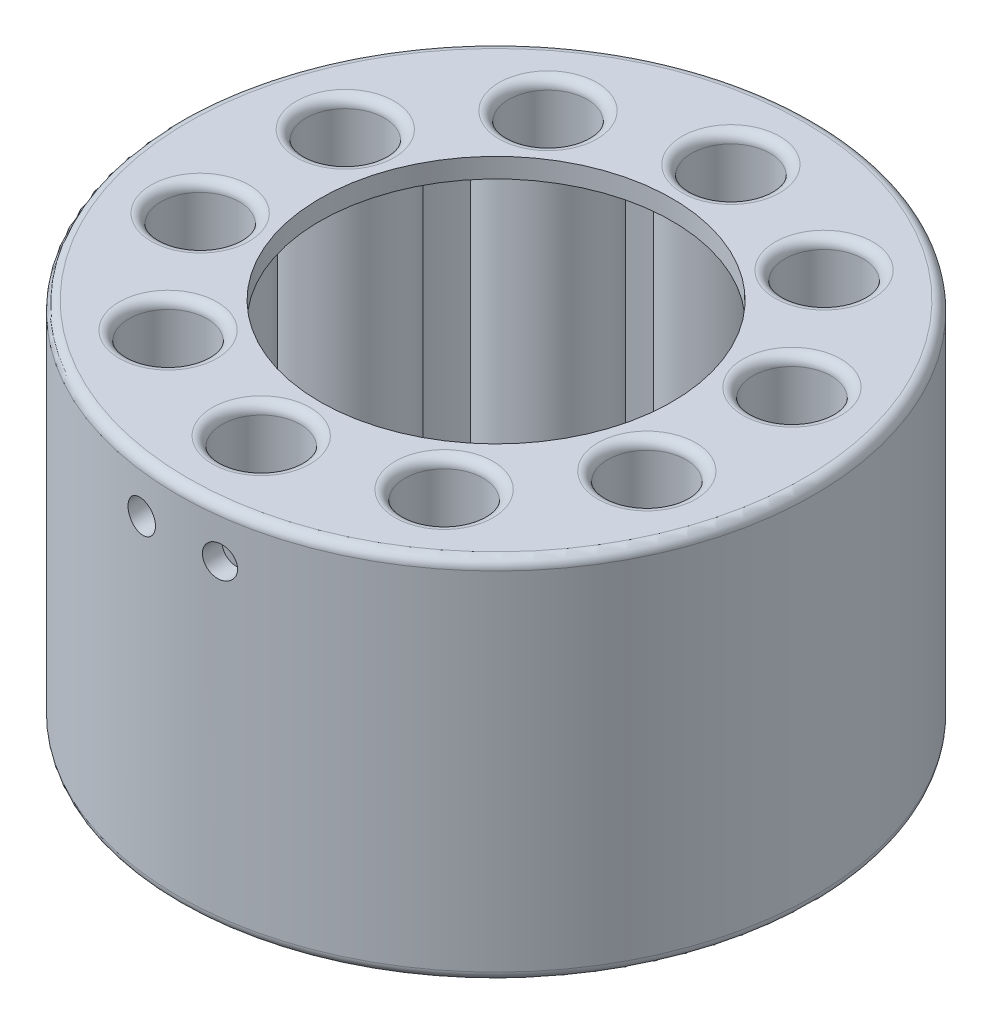
from build123d import *

# Parameters (mm, degrees)
SKETCH_5_R          = 32.5
SKETCH_5_R_2        = 4
EXTRUDE_1_DEPTH     = 2.5
SKETCH_5_4_R        = 32.5
SKETCH_5_4_R_2      = 30.5
SKETCH_5_4_R_3      = 5.6
SKETCH_5_4_R_4      = 4
EXTRUDE_2_DEPTH     = 37.5
SKETCH_6_R          = 32
EXTRUDE_3_DEPTH     = 2
SKETCH_5_5_R        = 4
CUT_EXTRUDE_1_DEPTH = 80
FILLET_1_R          = 1
FILLET_2_R          = 1
SKETCH_8_R          = 1.6
SKETCH_8_R_2        = 2.8
CUT_EXTRUDE_2_DEPTH = 5
SKETCH_15_R         = 1.6
CUT_EXTRUDE_3_DEPTH = 12
CUT_EXTRUDE_START   = 10
SKETCH_17_R         = 1.6
CUT_EXTRUDE_4_DEPTH = 10
SKETCH_18_R         = 18
CUT_EXTRUDE_5_DEPTH = 12


with BuildPart() as part:
    # 草图5 → 凸台-拉伸1 (new body)
    with BuildSketch(Plane(origin=(0, 0, 0), x_dir=(1, 0, 0), z_dir=(0, 1, 0))):
        Circle(SKETCH_5_R)
        with Locations((14.106846055, 19.416407865)):
            Circle(SKETCH_5_R_2, mode=Mode.SUBTRACT)
        with Locations((-14.106846055, -19.416407865)):
            Circle(SKETCH_5_R_2, mode=Mode.SUBTRACT)
        with Locations((-22.825356391, -7.416407865)):
            Circle(SKETCH_5_R_2, mode=Mode.SUBTRACT)
        with Locations((0, -24)):
            Circle(SKETCH_5_R_2, mode=Mode.SUBTRACT)
        with Locations((14.106846055, -19.416407865)):
            Circle(SKETCH_5_R_2, mode=Mode.SUBTRACT)
        with Locations((22.825356391, -7.416407865)):
            Circle(SKETCH_5_R_2, mode=Mode.SUBTRACT)
        with Locations((-22.825356391, 7.416407865)):
            Circle(SKETCH_5_R_2, mode=Mode.SUBTRACT)
        with Locations((-14.106846055, 19.416407865)):
            Circle(SKETCH_5_R_2, mode=Mode.SUBTRACT)
        with Locations((22.825356391, 7.416407865)):
            Circle(SKETCH_5_R_2, mode=Mode.SUBTRACT)
        with Locations((0, 24)):
            Circle(SKETCH_5_R_2, mode=Mode.SUBTRACT)
    extrude(amount=EXTRUDE_1_DEPTH)

    # 草图5<4> → 凸台-拉伸2 (add)
    # profile 1 of 11: a face of its own
    with BuildSketch(Plane(origin=(0, 0, 0), x_dir=(1, 0, 0), z_dir=(0, 1, 0))):
        Circle(SKETCH_5_4_R)
        Circle(SKETCH_5_4_R_2, mode=Mode.SUBTRACT)
    # profile 2 of 11: a face of its own
    with BuildSketch(Plane(origin=(0, 0, 0), x_dir=(1, 0, 0), z_dir=(0, 1, 0))):
        with Locations((0, 24)):
            Circle(SKETCH_5_4_R_3)
        with Locations((0, 24)):
            Circle(SKETCH_5_4_R_4, mode=Mode.SUBTRACT)
    # profile 3 of 11: a face of its own
    with BuildSketch(Plane(origin=(0, 0, 0), x_dir=(1, 0, 0), z_dir=(0, 1, 0))):
        with Locations((14.106846055, 19.416407865)):
            Circle(SKETCH_5_4_R_3)
        with Locations((14.106846055, 19.416407865)):
            Circle(SKETCH_5_4_R_4, mode=Mode.SUBTRACT)
    # profile 4 of 11: a face of its own
    with BuildSketch(Plane(origin=(0, 0, 0), x_dir=(1, 0, 0), z_dir=(0, 1, 0))):
        with Locations((22.825356391, 7.416407865)):
            Circle(SKETCH_5_4_R_3)
        with Locations((22.825356391, 7.416407865)):
            Circle(SKETCH_5_4_R_4, mode=Mode.SUBTRACT)
    # profile 5 of 11: a face of its own
    with BuildSketch(Plane(origin=(0, 0, 0), x_dir=(1, 0, 0), z_dir=(0, 1, 0))):
        with Locations((22.825356391, -7.416407865)):
            Circle(SKETCH_5_4_R_3)
        with Locations((22.825356391, -7.416407865)):
            Circle(SKETCH_5_4_R_4, mode=Mode.SUBTRACT)
    # profile 6 of 11: a face of its own
    with BuildSketch(Plane(origin=(0, 0, 0), x_dir=(1, 0, 0), z_dir=(0, 1, 0))):
        with Locations((14.106846055, -19.416407865)):
            Circle(SKETCH_5_4_R_3)
        with Locations((14.106846055, -19.416407865)):
            Circle(SKETCH_5_4_R_4, mode=Mode.SUBTRACT)
    # profile 7 of 11: a face of its own
    with BuildSketch(Plane(origin=(0, 0, 0), x_dir=(1, 0, 0), z_dir=(0, 1, 0))):
        with Locations((0, -24)):
            Circle(SKETCH_5_4_R_3)
        with Locations((0, -24)):
            Circle(SKETCH_5_4_R_4, mode=Mode.SUBTRACT)
    # profile 8 of 11: a face of its own
    with BuildSketch(Plane(origin=(0, 0, 0), x_dir=(1, 0, 0), z_dir=(0, 1, 0))):
        with Locations((-14.106846055, -19.416407865)):
            Circle(SKETCH_5_4_R_3)
        with Locations((-14.106846055, -19.416407865)):
            Circle(SKETCH_5_4_R_4, mode=Mode.SUBTRACT)
    # profile 9 of 11: a face of its own
    with BuildSketch(Plane(origin=(0, 0, 0), x_dir=(1, 0, 0), z_dir=(0, 1, 0))):
        with Locations((-22.825356391, -7.416407865)):
            Circle(SKETCH_5_4_R_3)
        with Locations((-22.825356391, -7.416407865)):
            Circle(SKETCH_5_4_R_4, mode=Mode.SUBTRACT)
    # profile 10 of 11: a face of its own
    with BuildSketch(Plane(origin=(0, 0, 0), x_dir=(1, 0, 0), z_dir=(0, 1, 0))):
        with Locations((-22.825356391, 7.416407865)):
            Circle(SKETCH_5_4_R_3)
        with Locations((-22.825356391, 7.416407865)):
            Circle(SKETCH_5_4_R_4, mode=Mode.SUBTRACT)
    # profile 11 of 11: a face of its own
    with BuildSketch(Plane(origin=(0, 0, 0), x_dir=(1, 0, 0), z_dir=(0, 1, 0))):
        with Locations((-14.106846055, 19.416407865)):
            Circle(SKETCH_5_4_R_3)
        with Locations((-14.106846055, 19.416407865)):
            Circle(SKETCH_5_4_R_4, mode=Mode.SUBTRACT)
    extrude(amount=EXTRUDE_2_DEPTH)

    # 草图6 → 凸台-拉伸3 (add)
    with BuildSketch(Plane(origin=(0, 37.5, 0), x_dir=(1, 0, 0), z_dir=(0, 1, 0))):
        Circle(SKETCH_6_R)
    extrude(amount=-EXTRUDE_3_DEPTH)

    # 草图5<5> → 切除-拉伸1 (cut)
    with BuildSketch(Plane(origin=(0, 0, 0), x_dir=(1, 0, 0), z_dir=(0, 1, 0))):
        with Locations((0, 24)):
            Circle(SKETCH_5_5_R)
        with Locations((14.106846055, 19.416407865)):
            Circle(SKETCH_5_5_R)
        with Locations((22.825356391, 7.416407865)):
            Circle(SKETCH_5_5_R)
        with Locations((22.825356391, -7.416407865)):
            Circle(SKETCH_5_5_R)
        with Locations((14.106846055, -19.416407865)):
            Circle(SKETCH_5_5_R)
        with Locations((0, -24)):
            Circle(SKETCH_5_5_R)
        with Locations((-14.106846055, -19.416407865)):
            Circle(SKETCH_5_5_R)
        with Locations((-22.825356391, -7.416407865)):
            Circle(SKETCH_5_5_R)
        with Locations((-22.825356391, 7.416407865)):
            Circle(SKETCH_5_5_R)
        with Locations((-14.106846055, 19.416407865)):
            Circle(SKETCH_5_5_R)
    extrude(amount=CUT_EXTRUDE_1_DEPTH, mode=Mode.SUBTRACT)

    # 圆角1
    fillet_1_edges = [part.edges().sort_by_distance(p)[0] for p in [
        (-32.5, 37.5, 0),
        (-32.5, 0, 0),
    ]]
    fillet(fillet_1_edges, radius=FILLET_1_R)

    # 圆角2
    fillet_2_edges = [part.edges().sort_by_distance(p)[0] for p in [
        (-26.825356391, 37.5, -7.416407865),
        (-26.825356391, 37.5, 7.416407865),
        (-18.106846055, 37.5, 19.416407865),
        (-4, 37.5, 24),
        (10.106846055, 37.5, 19.416407865),
        (18.825356391, 37.5, 7.416407865),
        (18.825356391, 37.5, -7.416407865),
        (10.106846055, 37.5, -19.416407865),
        (-4, 37.5, -24),
        (-18.106846055, 37.5, -19.416407865),
    ]]
    fillet(fillet_2_edges, radius=FILLET_2_R)

    # 草图8 → 切除-拉伸2 (cut)
    with BuildSketch(Plane.XZ):
        with Locations((0, 7)):
            Circle(SKETCH_8_R)
        with Locations((7, 0)):
            Circle(SKETCH_8_R)
        with Locations((0, -7)):
            Circle(SKETCH_8_R)
        with Locations((-7, 0)):
            Circle(SKETCH_8_R)
        Circle(SKETCH_8_R_2)
    extrude(amount=-CUT_EXTRUDE_2_DEPTH, mode=Mode.SUBTRACT)

    # 草图15 → 切除-拉伸3 (cut)
    with BuildSketch(Plane.XY.offset(41.359380759)):
        with Locations((-4, 32.5)):
            Circle(SKETCH_15_R)
        with Locations((4, 32.5)):
            Circle(SKETCH_15_R)
    extrude(amount=-CUT_EXTRUDE_3_DEPTH, mode=Mode.SUBTRACT)

    # 草图17 → 切除-拉伸4 (cut)
    with BuildSketch(Plane.XY.offset(-39.7780737).offset(CUT_EXTRUDE_START)):
        with Locations((4, 32.5)):
            Circle(SKETCH_17_R)
        with Locations((-4, 32.5)):
            Circle(SKETCH_17_R)
    extrude(amount=-CUT_EXTRUDE_4_DEPTH, mode=Mode.SUBTRACT)

    # 草图18 → 切除-拉伸5 (cut)
    with BuildSketch(Plane(origin=(0, 37.5, 0), x_dir=(1, 0, 0), z_dir=(0, 1, 0))):
        Circle(SKETCH_18_R)
    extrude(amount=-CUT_EXTRUDE_5_DEPTH, mode=Mode.SUBTRACT)


solid = part.part
